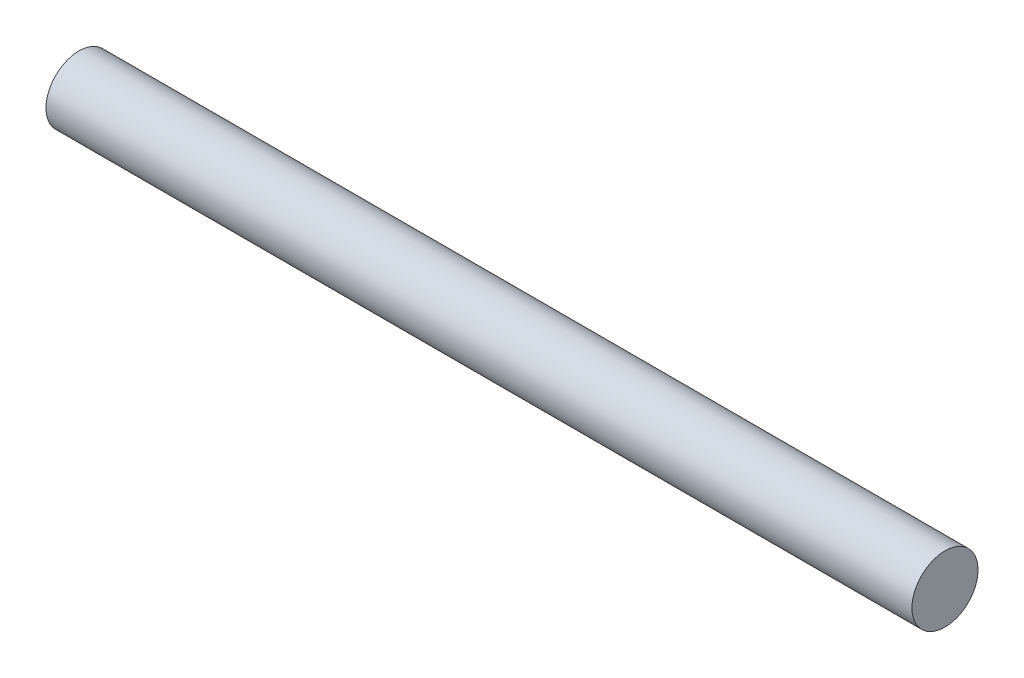
from build123d import *

# Parameters (mm, degrees)
SKETCH2_R           = 1.985
BOSS_EXTRUDE1_DEPTH = 52


with BuildPart() as part:
    # Sketch2 → Boss-Extrude1 (new body)
    with BuildSketch(Plane(origin=(0, 0, 0), x_dir=(0, 0, -1), z_dir=(1, 0, 0))):
        Circle(SKETCH2_R)
    extrude(amount=BOSS_EXTRUDE1_DEPTH)


solid = part.part
